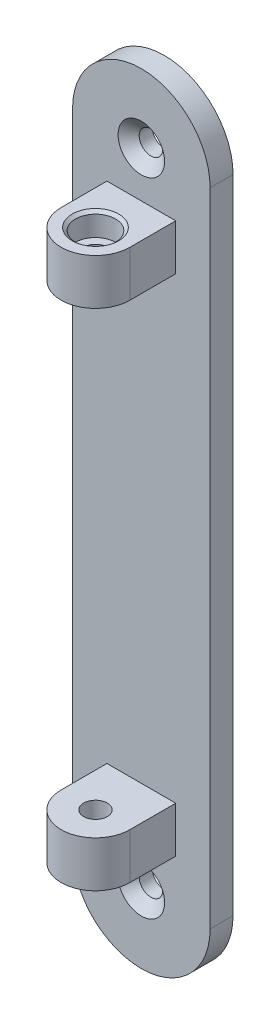
from build123d import *

# Parameters (mm, degrees)
BOSS_EXTRUDE1_DEPTH                                 = 6.35
CSK_FOR_1_4_FLAT_HEAD_MACHINE_SCREW_100_D           = 6.5278
CSK_FOR_1_4_FLAT_HEAD_MACHINE_SCREW_100_CSINK_D     = 12.8778
CSK_FOR_1_4_FLAT_HEAD_MACHINE_SCREW_100_CSINK_ANGLE = 100
SKETCH5_W                                           = 19.05
SKETCH5_H                                           = 12.7
BOSS_EXTRUDE2_DEPTH                                 = 12.7
BOSS_EXTRUDE3_DEPTH                                 = 12.7


# Read off the part's stored shape, not the designer's step: CBORE for 1/4 Socket Head Cap Screw1
with BuildPart() as part:
    # Sketch1 → Boss-Extrude1 (new body)
    with BuildSketch(Plane.XY):
        with BuildLine():
            Line((0, 0), (0, 88.9))
            ThreePointArc((0, 88.9), (19.05, 107.95), (38.1, 88.9))
            Line((38.1, 88.9), (38.1, 0))
            Line((38.1, 0), (0, 0))
        make_face()
    extrude(amount=-BOSS_EXTRUDE1_DEPTH)

    # CSK for 1/4 Flat Head Machine Screw (100)1 (through all)
    with Locations(Plane.XY):
        with Locations((19.05, 88.9)):
            CounterSinkHole(CSK_FOR_1_4_FLAT_HEAD_MACHINE_SCREW_100_D / 2, CSK_FOR_1_4_FLAT_HEAD_MACHINE_SCREW_100_CSINK_D / 2, counter_sink_angle=CSK_FOR_1_4_FLAT_HEAD_MACHINE_SCREW_100_CSINK_ANGLE)

    # Sketch5 → Boss-Extrude2 (add)
    with BuildSketch(Plane.XY):
        with Locations((19.05, 69.85)):
            Rectangle(SKETCH5_W, SKETCH5_H)
    extrude(amount=BOSS_EXTRUDE2_DEPTH)

    # Sketch6 → Boss-Extrude3 (add)
    with BuildSketch(Plane(origin=(0, 76.2, 0), x_dir=(1, 0, 0), z_dir=(0, 1, 0))):
        with BuildLine():
            Line((9.525, -12.7), (28.575, -12.7))
            ThreePointArc((28.575, -12.7), (19.05, -22.225), (9.525, -12.7))
        make_face()
    extrude(amount=-BOSS_EXTRUDE3_DEPTH)

    # CBORE for 1/4 Socket Head Cap Screw1 out → CBORE for 1/4 Socket Head Cap Screw1 (revolve, cut)
    with BuildSketch(Plane(origin=(19.05, 0, 12.7), x_dir=(1, 0, 0), z_dir=(0, 0, 1))):
        Polygon((0, 63.5), (3.2639, 63.5), (3.2639, 69.85), (5.55625, 69.85), (5.55625, 75.459368711), (6.4389, 76.2), (0, 76.2), align=None)
    revolve(axis=Axis((19.05, 0, 12.7), (0, 1, 0)), mode=Mode.SUBTRACT)

    # Mirror1: part across plane


with BuildPart() as part_1:
    add(part.part)
    add(part.part.mirror(Plane(origin=(38.1, 0, -6.35), x_dir=(0, 0, 1), z_dir=(0, -1, 0))))


solid = part_1.part
